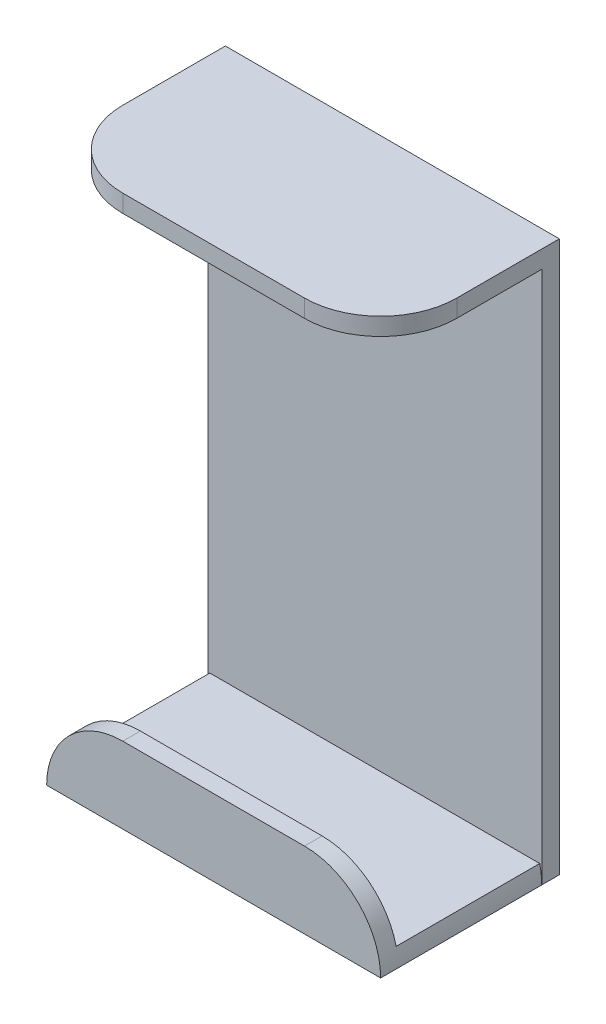
from build123d import *

# Parameters (mm, degrees)
SKETCH2_W               = 57
SKETCH2_H               = 33.5
BOSS_EXTRUDE1_DEPTH     = 100
CUT_EXTRUDE3_DEPTH      = 120.880148482
CUT_EXTRUDE3_DEPTH_BACK = 120.880148482
CUT_EXTRUDE5_DEPTH      = 100
FILLET2_R               = 13


with BuildPart() as part:
    # Sketch2 → Boss-Extrude1 (new body)
    with BuildSketch(Plane(origin=(0, 0, 0), x_dir=(1, 0, 0), z_dir=(0, 1, 0))):
        with Locations((28.5, 16.75)):
            Rectangle(SKETCH2_W, SKETCH2_H)
    extrude(amount=BOSS_EXTRUDE1_DEPTH)

    # Sketch3 → Cut-Extrude3 (cut, two sides: drawn at the far end of the back side and taken through both)
    with BuildSketch(Plane(origin=(57, 0, 0), x_dir=(0, 0, -1), z_dir=(1, 0, 0)).offset(-CUT_EXTRUDE3_DEPTH_BACK)):
        Polygon((0, 100), (0, 97), (30.5, 97), (30.5, 3), (0, 3), (0, 0), (33.5, 0), (33.5, 100), align=None)
    extrude(amount=CUT_EXTRUDE3_DEPTH + CUT_EXTRUDE3_DEPTH_BACK, mode=Mode.SUBTRACT)

    # Sketch4 → Cut-Extrude5 (cut)
    with BuildSketch(Plane(origin=(57, 0, 0), x_dir=(0, 0, -1), z_dir=(1, 0, 0))):
        Polygon((0, 94), (27.5, 94), (27.5, 6), (3, 6), (3, 16), (0, 16), align=None)
    extrude(amount=-CUT_EXTRUDE5_DEPTH, mode=Mode.SUBTRACT)

    # Fillet2
    # the kernel refuses this fillet: 13 mm, written as the material it takes off along each edge
    with BuildSketch(Plane(origin=(0, 61.5, 0), x_dir=(0, 0, -1), z_dir=(0, 1, 0)), Plane(origin=(57, 61.5, 0), x_dir=(-1, 0, 0), z_dir=(0, 1, 0))) as fillet2_piece_1:
        with BuildLine():
            CenterArc((FILLET2_R, -FILLET2_R), FILLET2_R, 90, 90)
            Line((0, -FILLET2_R), (0, 0))
            Line((0, 0), (FILLET2_R, 0))
        make_face()
    extrude(amount=68, mode=Mode.SUBTRACT)
    with BuildSketch(Plane(origin=(57, 16, -35.5), x_dir=(-1, 0, 0), z_dir=(0, 0, 1))) as fillet2_piece_2_section:
        with BuildLine():
            CenterArc((FILLET2_R, FILLET2_R), FILLET2_R, 180, 90)
            Line((0, FILLET2_R), (0, 0))
            Line((0, 0), (FILLET2_R, 0))
        make_face()
    fillet2_piece_2 = extrude(amount=68, mode=Mode.PRIVATE)
    fillet2_piece_2 = split(fillet2_piece_2, bisect_by=Plane(origin=(56.894981294, 5.25203924, -27.5), z_dir=(0, 0, 1)), keep=Keep.TOP, mode=Mode.PRIVATE)
    add(fillet2_piece_2, mode=Mode.SUBTRACT)
    with BuildSketch(Plane(origin=(0, 16, 32.5), x_dir=(0, -1, 0), z_dir=(0, 0, -1))) as fillet2_piece_3_section:
        with BuildLine():
            CenterArc((FILLET2_R, -FILLET2_R), FILLET2_R, 90, 90)
            Line((0, -FILLET2_R), (0, 0))
            Line((0, 0), (FILLET2_R, 0))
        make_face()
    fillet2_piece_3 = extrude(amount=68, mode=Mode.PRIVATE)
    fillet2_piece_3 = split(fillet2_piece_3, bisect_by=Plane(origin=(0.105018706, 5.25203924, -27.5), z_dir=(0, 0, 1)), keep=Keep.TOP, mode=Mode.PRIVATE)
    add(fillet2_piece_3, mode=Mode.SUBTRACT)


solid = part.part
